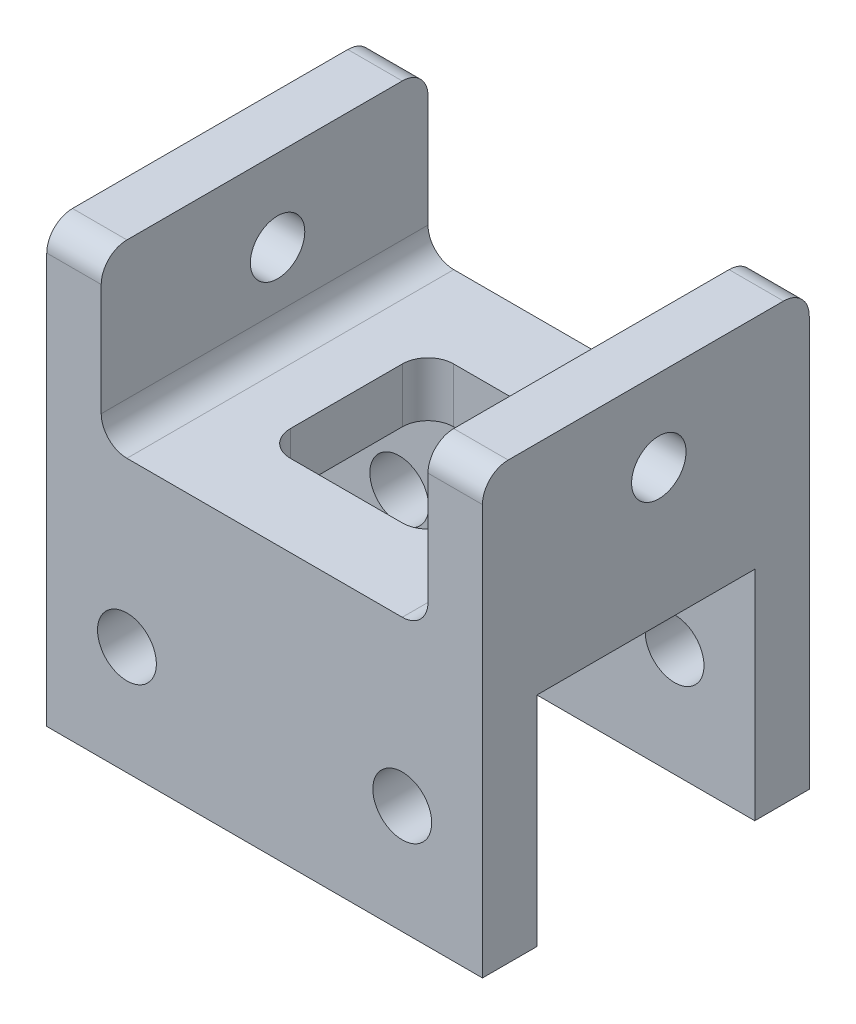
from build123d import *

# Parameters (mm, degrees)
SKETCH1_W               = 50.8
SKETCH1_H               = 38.1
BOSS_EXTRUDE1_DEPTH     = 31.75
SKETCH2_W               = 25.4
SKETCH2_H               = 25.4
CUT_EXTRUDE1_DEPTH      = 85.79053849
SKETCH3_W               = 6.35
SKETCH3_H               = 38.1
BOSS_EXTRUDE2_DEPTH     = 19.05
SKETCH4_W               = 6.35
SKETCH4_H               = 38.1
BOSS_EXTRUDE3_DEPTH     = 19.05
CUT_EXTRUDE2_DEPTH      = 91.317082645
CUT_EXTRUDE2_DEPTH_BACK = 91.317082645
SKETCH5_R               = 3.175
FILLET1_R               = 3
SKETCH6_R               = 3.429
CUT_EXTRUDE3_DEPTH      = 127.788108172
SKETCH7_R               = 3.429
CUT_EXTRUDE4_DEPTH      = 127.788108172
SKETCH8_W               = 19.05
SKETCH8_H               = 19.05
CUT_EXTRUDE5_DEPTH      = 130.041736625
FILLET2_R               = 3
FILLET3_R               = 3


with BuildPart() as part:
    # Sketch1 → Boss-Extrude1 (new body)
    with BuildSketch(Plane(origin=(0, 0, 0), x_dir=(1, 0, 0), z_dir=(0, 1, 0))):
        with Locations((-84.340486484, 40.956107335)):
            Rectangle(SKETCH1_W, SKETCH1_H)
    extrude(amount=BOSS_EXTRUDE1_DEPTH)

    # Sketch2 → Cut-Extrude1 (cut, through all)
    with BuildSketch(Plane(origin=(-58.940486484, 0, 0), x_dir=(0, 0, -1), z_dir=(1, 0, 0))):
        with Locations((40.956107335, 12.7)):
            Rectangle(SKETCH2_W, SKETCH2_H)
    extrude(amount=-CUT_EXTRUDE1_DEPTH, mode=Mode.SUBTRACT)

    # Sketch3 → Boss-Extrude2 (add)
    with BuildSketch(Plane(origin=(0, 31.75, 0), x_dir=(1, 0, 0), z_dir=(0, 1, 0))):
        with Locations((-106.565486484, 40.956107335)):
            Rectangle(SKETCH3_W, SKETCH3_H)
    extrude(amount=BOSS_EXTRUDE2_DEPTH)

    # Sketch4 → Boss-Extrude3 (add)
    with BuildSketch(Plane(origin=(0, 31.75, 0), x_dir=(1, 0, 0), z_dir=(0, 1, 0))):
        with Locations((-62.115486484, 40.956107335)):
            Rectangle(SKETCH4_W, SKETCH4_H)
    extrude(amount=BOSS_EXTRUDE3_DEPTH)

    # Sketch5 → Cut-Extrude2 (cut, two sides: drawn at the far end of the back side and taken through both)
    with BuildSketch(Plane(origin=(-103.390486484, 0, 0), x_dir=(0, 0, -1), z_dir=(1, 0, 0)).offset(-CUT_EXTRUDE2_DEPTH_BACK)):
        with Locations((42.465557169, 41.275)):
            Circle(SKETCH5_R)
    extrude(amount=CUT_EXTRUDE2_DEPTH + CUT_EXTRUDE2_DEPTH_BACK, mode=Mode.SUBTRACT)

    # Fillet1
    fillet1_edges = [part.edges().sort_by_distance(p)[0] for p in [
        (-106.565486484, 50.8, -60.006107335),
        (-106.565486484, 50.8, -21.906107335),
        (-62.115486484, 50.8, -21.906107335),
        (-62.115486484, 50.8, -60.006107335),
        (-65.290486484, 31.75, -40.956107335),
        (-103.390486484, 31.75, -40.956107335),
    ]]
    fillet(fillet1_edges, radius=FILLET1_R)

    # Sketch6 → Cut-Extrude3 (cut, through all)
    with BuildSketch(Plane(origin=(0, 0, -60.006107335), x_dir=(-1, 0, 0), z_dir=(0, 0, -1))):
        with Locations((68.290486484, 12.7)):
            Circle(SKETCH6_R)
    extrude(amount=-CUT_EXTRUDE3_DEPTH, mode=Mode.SUBTRACT)

    # Sketch7 → Cut-Extrude4 (cut, through all)
    with BuildSketch(Plane(origin=(0, 0, -60.006107335), x_dir=(-1, 0, 0), z_dir=(0, 0, -1))):
        with Locations((100.390486484, 12.7)):
            Circle(SKETCH7_R)
    extrude(amount=-CUT_EXTRUDE4_DEPTH, mode=Mode.SUBTRACT)

    # Sketch8 → Cut-Extrude5 (cut, through all)
    with BuildSketch(Plane(origin=(0, 31.75, 0), x_dir=(1, 0, 0), z_dir=(0, 1, 0))):
        with Locations((-84.340486484, 40.956107335)):
            Rectangle(SKETCH8_W, SKETCH8_H)
    extrude(amount=-CUT_EXTRUDE5_DEPTH, mode=Mode.SUBTRACT)

    # Fillet2
    fillet2_edges = [part.edges().sort_by_distance(p)[0] for p in [
        (-93.865486484, 28.575, -50.481107335),
        (-93.865486484, 28.575, -31.431107335),
    ]]
    fillet(fillet2_edges, radius=FILLET2_R)

    # Fillet3
    fillet3_edges = [part.edges().sort_by_distance(p)[0] for p in [
        (-74.815486484, 28.575, -31.431107335),
        (-74.815486484, 28.575, -50.481107335),
    ]]
    fillet(fillet3_edges, radius=FILLET3_R)


solid = part.part
